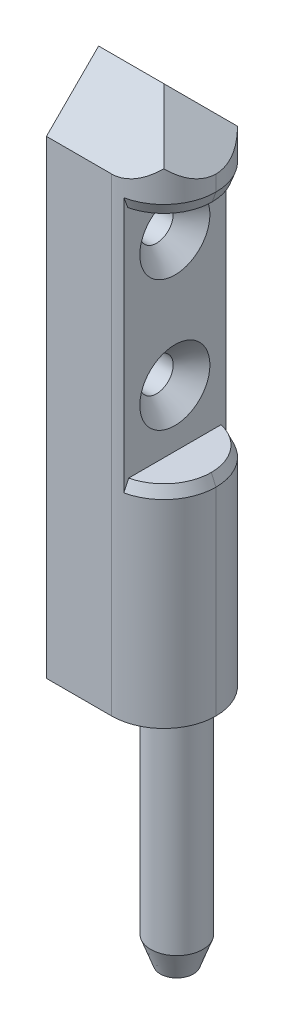
from build123d import *

# Parameters (mm, degrees)
DODANIE_WYCI_GNI_CIE1_DEPTH                        = 100
SFAZOWANIE1_SIZE                                   = 10
ZAOKR_GLENIE1_R                                    = 10
SZKIC3_W                                           = 20
SZKIC3_H                                           = 45
WYTNIJ_WYCI_GNI_CIE1_DEPTH                         = 100
SFAZOWANIE2_SIZE2                                  = 0.890457371
SFAZOWANIE2_SIZE                                   = 2
SFAZOWANIE3_SIZE2                                  = 0.727940469
SFAZOWANIE3_SIZE                                   = 2
POG_BIENIE_STO_KOWE_POD_M6_WKR_T_Z_BEM_D           = 6.4
POG_BIENIE_STO_KOWE_POD_M6_WKR_T_Z_BEM_DEPTH       = 40
POG_BIENIE_STO_KOWE_POD_M6_WKR_T_Z_BEM_CSINK_D     = 13.44
POG_BIENIE_STO_KOWE_POD_M6_WKR_T_Z_BEM_CSINK_ANGLE = 90
POG_BIENIE_STO_KOWE_POD_M6_WKR_T_Z_BEM_TIP         = 1.922753981
SZKIC7_R                                           = 5
DODANIE_WYCI_GNI_CIE2_DEPTH                        = 45
SFAZOWANIE5_SIZE                                   = 5
SFAZOWANIE5_SIZE2                                  = 1.819851171


with BuildPart() as part:
    # Szkic2 → Dodanie-wyciągnięcie1 (new body)
    with BuildSketch(Plane(origin=(0, 0, 0), x_dir=(1, 0, 0), z_dir=(0, 1, 0))):
        Polygon((2.12, 10), (22.5, 10), (22.5, -10), (2.12, -10), (0, -10), (0, 10), align=None)
    extrude(amount=DODANIE_WYCI_GNI_CIE1_DEPTH)

    # Sfazowanie1
    sfazowanie1_edges = [part.edges().sort_by_distance(p)[0] for p in [
        (11.25, 100, -10),
        (22.5, 100, 0),
        (11.25, 100, 10),
    ]]
    chamfer(sfazowanie1_edges, length=SFAZOWANIE1_SIZE - 0.0001)  # a hair under: the kernel refuses the full size

    # Zaokrąglenie1
    zaokr_glenie1_edges = [part.edges().sort_by_distance(p)[0] for p in [
        (22.5, 45.00005, -10),
        (22.5, 45.00005, 10),
    ]]
    fillet(zaokr_glenie1_edges, radius=ZAOKR_GLENIE1_R - 0.0001)  # a hair under: the kernel refuses the full size

    # Szkic3 → Wytnij-wyciągnięcie1 (cut)
    with BuildSketch(Plane(origin=(14.62, 0, 0), x_dir=(0, 0, -1), z_dir=(1, 0, 0))):
        with Locations((0, 62.5)):
            Rectangle(SZKIC3_W, SZKIC3_H)
    extrude(amount=WYTNIJ_WYCI_GNI_CIE1_DEPTH, mode=Mode.SUBTRACT)

    # Sfazowanie2
    sfazowanie2_edges = [part.edges().sort_by_distance(p)[0] for p in [
        (20.28459703, 40, -6.277010546),
        (20.28459703, 40, 6.277010546),
    ]]
    chamfer(sfazowanie2_edges, length=SFAZOWANIE2_SIZE, length2=SFAZOWANIE2_SIZE2)

    # Sfazowanie3
    sfazowanie3_edges = [part.edges().sort_by_distance(p)[0] for p in [
        (20.28459703, 85, -6.277010546),
        (20.28459703, 85, 6.277010546),
    ]]
    chamfer(sfazowanie3_edges, length=SFAZOWANIE3_SIZE, length2=SFAZOWANIE3_SIZE2)

    # Pogłębienie stożkowe pod M6 Wkręt z łbem stożkowym płaskim2
    with Locations(Plane(origin=(14.62, 0, 0), x_dir=(0, 0, -1), z_dir=(1, 0, 0))):
        with Locations((0, 51), (0, 76)):
            CounterSinkHole(POG_BIENIE_STO_KOWE_POD_M6_WKR_T_Z_BEM_D / 2, POG_BIENIE_STO_KOWE_POD_M6_WKR_T_Z_BEM_CSINK_D / 2, depth=POG_BIENIE_STO_KOWE_POD_M6_WKR_T_Z_BEM_DEPTH, counter_sink_angle=POG_BIENIE_STO_KOWE_POD_M6_WKR_T_Z_BEM_CSINK_ANGLE)
            with Locations((0, 0, -(POG_BIENIE_STO_KOWE_POD_M6_WKR_T_Z_BEM_DEPTH + POG_BIENIE_STO_KOWE_POD_M6_WKR_T_Z_BEM_TIP / 2))):  # 118° drill point
                Cone(0, POG_BIENIE_STO_KOWE_POD_M6_WKR_T_Z_BEM_D / 2, POG_BIENIE_STO_KOWE_POD_M6_WKR_T_Z_BEM_TIP, mode=Mode.SUBTRACT)

    # Szkic7 → Dodanie-wyciągnięcie2 (add)
    with BuildSketch(Plane.XZ):
        with Locations(Location((15, 0, 0), (0, 0, 90))):
            Circle(SZKIC7_R)
    extrude(amount=DODANIE_WYCI_GNI_CIE2_DEPTH)

    # Sfazowanie5
    sfazowanie5_edges = [part.edges().sort_by_distance(p)[0] for p in [
        (15, -45, -5),
    ]]
    sfazowanie5_side = [part.faces().sort_by_distance(p)[0] for p in [
        (15, -22.5, -5),
    ]]
    chamfer(sfazowanie5_edges, length=SFAZOWANIE5_SIZE, length2=SFAZOWANIE5_SIZE2, reference=sfazowanie5_side[0])


solid = part.part
